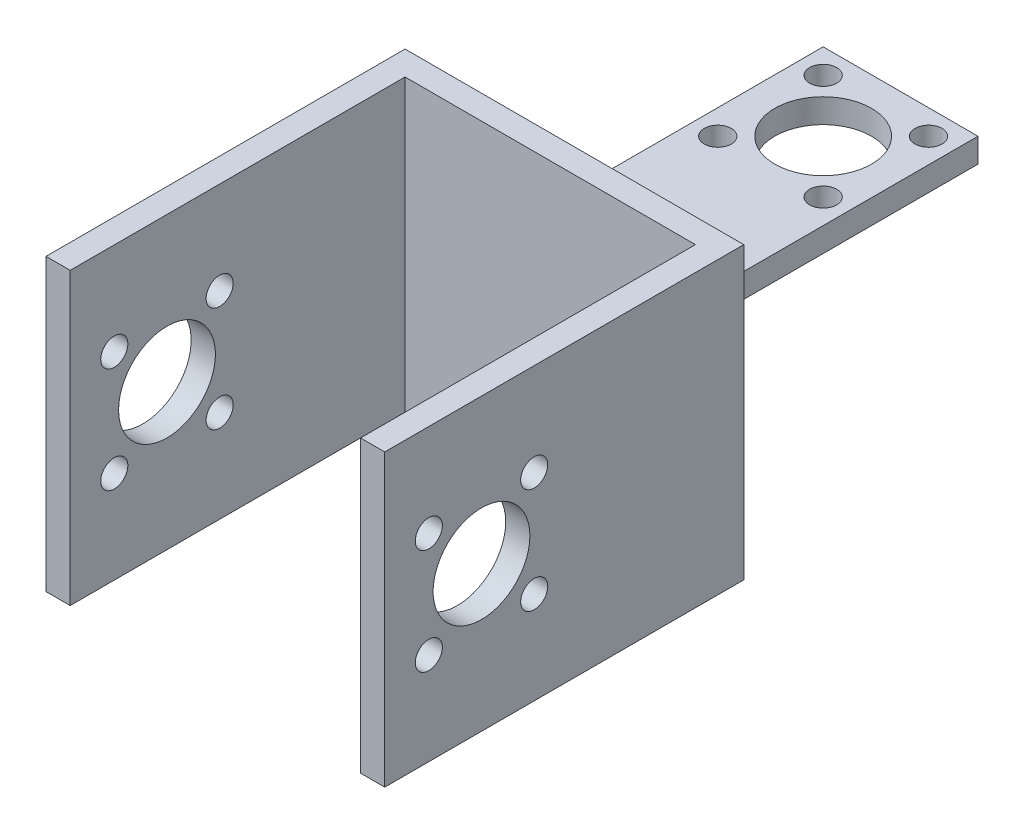
from build123d import *

# Parameters (mm, degrees)
BOSS_EXTRUDE1_DEPTH = 19.05
SKETCH3_W           = 20.32
SKETCH3_H           = 43.561
CUT_EXTRUDE1_DEPTH  = 19.05
SKETCH4_W           = 20.32
SKETCH4_H           = 43.561
CUT_EXTRUDE2_DEPTH  = 15.875
CUT_EXTRUDE3_REACH  = 100.572
SKETCH6_R           = 6.35
SKETCH6_R_2         = 1.778
CUT_EXTRUDE6_REACH  = 104.768
SKETCH9_R           = 6.35
SKETCH9_R_2         = 1.778
CUT_EXTRUDE7_REACH  = 104.768
SKETCH10_R          = 6.35
SKETCH10_R_2        = 1.778


with BuildPart() as part:
    # Sketch1 → Boss-Extrude1 (new, symmetric)
    with BuildSketch(Plane(origin=(0, 0, 0), x_dir=(1, 0, 0), z_dir=(0, 1, 0))):
        Polygon((0, 0), (-20.32, 0), (-20.32, -43.561), (-31.623, -43.561), (-31.623, -90.678), (-28.448, -90.678), (-28.448, -46.736), (9.652, -46.736), (9.652, -90.678), (12.827, -90.678), (12.827, -43.561), (0, -43.561), align=None)
    extrude(amount=BOSS_EXTRUDE1_DEPTH, both=True)

    # Sketch3 → Cut-Extrude1 (cut)
    with BuildSketch(Plane.XZ.offset(19.05)):
        with Locations((-10.16, 21.7805)):
            Rectangle(SKETCH3_W, SKETCH3_H)
    extrude(amount=-CUT_EXTRUDE1_DEPTH, mode=Mode.SUBTRACT)

    # Sketch4 → Cut-Extrude2 (cut)
    with BuildSketch(Plane(origin=(0, 19.05, 0), x_dir=(1, 0, 0), z_dir=(0, 1, 0))):
        with Locations((-10.16, -21.7805)):
            Rectangle(SKETCH4_W, SKETCH4_H)
    extrude(amount=-CUT_EXTRUDE2_DEPTH, mode=Mode.SUBTRACT)

    # Sketch6 → Cut-Extrude3 (cut, up to next)
    with BuildSketch(Plane(origin=(0, 3.175, 0), x_dir=(1, 0, 0), z_dir=(0, 1, 0)), mode=Mode.PRIVATE) as cut_extrude3_sk1:
        with Locations((-10.16, -10.16)):
            Circle(SKETCH6_R)
    cut_extrude3_tool1 = extrude(cut_extrude3_sk1.sketch, amount=-CUT_EXTRUDE3_REACH, mode=Mode.PRIVATE) & part.part
    # Sketch6 → Cut-Extrude3 (cut, up to next)
    with BuildSketch(Plane(origin=(0, 3.175, 0), x_dir=(1, 0, 0), z_dir=(0, 1, 0)), mode=Mode.PRIVATE) as cut_extrude3_sk2:
        with Locations((-17.074797213, -17.074797213)):
            Circle(SKETCH6_R_2)
    cut_extrude3_tool2 = extrude(cut_extrude3_sk2.sketch, amount=-CUT_EXTRUDE3_REACH, mode=Mode.PRIVATE) & part.part
    # Sketch6 → Cut-Extrude3 (cut, up to next)
    with BuildSketch(Plane(origin=(0, 3.175, 0), x_dir=(1, 0, 0), z_dir=(0, 1, 0)), mode=Mode.PRIVATE) as cut_extrude3_sk3:
        with Locations((-17.074797213, -3.245202787)):
            Circle(SKETCH6_R_2)
    cut_extrude3_tool3 = extrude(cut_extrude3_sk3.sketch, amount=-CUT_EXTRUDE3_REACH, mode=Mode.PRIVATE) & part.part
    # Sketch6 → Cut-Extrude3 (cut, up to next)
    with BuildSketch(Plane(origin=(0, 3.175, 0), x_dir=(1, 0, 0), z_dir=(0, 1, 0)), mode=Mode.PRIVATE) as cut_extrude3_sk4:
        with Locations((-3.245202787, -3.245202787)):
            Circle(SKETCH6_R_2)
    cut_extrude3_tool4 = extrude(cut_extrude3_sk4.sketch, amount=-CUT_EXTRUDE3_REACH, mode=Mode.PRIVATE) & part.part
    # Sketch6 → Cut-Extrude3 (cut, up to next)
    with BuildSketch(Plane(origin=(0, 3.175, 0), x_dir=(1, 0, 0), z_dir=(0, 1, 0)), mode=Mode.PRIVATE) as cut_extrude3_sk5:
        with Locations((-3.245202787, -17.074797213)):
            Circle(SKETCH6_R_2)
    cut_extrude3_tool5 = extrude(cut_extrude3_sk5.sketch, amount=-CUT_EXTRUDE3_REACH, mode=Mode.PRIVATE) & part.part
    add(cut_extrude3_tool1.solids().sort_by_distance((-10.16, 3.175, 10.16))[0], mode=Mode.SUBTRACT)
    add(cut_extrude3_tool2.solids().sort_by_distance((-17.074797, 3.175, 17.074797))[0], mode=Mode.SUBTRACT)
    add(cut_extrude3_tool3.solids().sort_by_distance((-17.074797, 3.175, 3.245203))[0], mode=Mode.SUBTRACT)
    add(cut_extrude3_tool4.solids().sort_by_distance((-3.245203, 3.175, 3.245203))[0], mode=Mode.SUBTRACT)
    add(cut_extrude3_tool5.solids().sort_by_distance((-3.245203, 3.175, 17.074797))[0], mode=Mode.SUBTRACT)

    # Sketch9 → Cut-Extrude6 (cut, up to next)
    with BuildSketch(Plane(origin=(12.827, 0, 0), x_dir=(0, 0, -1), z_dir=(1, 0, 0)), mode=Mode.PRIVATE) as cut_extrude6_sk1:
        with Locations((-77.978, 0)):
            Circle(SKETCH9_R)
    cut_extrude6_tool1 = extrude(cut_extrude6_sk1.sketch, amount=-CUT_EXTRUDE6_REACH, mode=Mode.PRIVATE) & part.part
    # Sketch9 → Cut-Extrude6 (cut, up to next)
    with BuildSketch(Plane(origin=(12.827, 0, 0), x_dir=(0, 0, -1), z_dir=(1, 0, 0)), mode=Mode.PRIVATE) as cut_extrude6_sk2:
        with Locations((-84.892797213, 6.914797213)):
            Circle(SKETCH9_R_2)
    cut_extrude6_tool2 = extrude(cut_extrude6_sk2.sketch, amount=-CUT_EXTRUDE6_REACH, mode=Mode.PRIVATE) & part.part
    # Sketch9 → Cut-Extrude6 (cut, up to next)
    with BuildSketch(Plane(origin=(12.827, 0, 0), x_dir=(0, 0, -1), z_dir=(1, 0, 0)), mode=Mode.PRIVATE) as cut_extrude6_sk3:
        with Locations((-71.063202787, 6.914797213)):
            Circle(SKETCH9_R_2)
    cut_extrude6_tool3 = extrude(cut_extrude6_sk3.sketch, amount=-CUT_EXTRUDE6_REACH, mode=Mode.PRIVATE) & part.part
    # Sketch9 → Cut-Extrude6 (cut, up to next)
    with BuildSketch(Plane(origin=(12.827, 0, 0), x_dir=(0, 0, -1), z_dir=(1, 0, 0)), mode=Mode.PRIVATE) as cut_extrude6_sk4:
        with Locations((-71.063202787, -6.914797213)):
            Circle(SKETCH9_R_2)
    cut_extrude6_tool4 = extrude(cut_extrude6_sk4.sketch, amount=-CUT_EXTRUDE6_REACH, mode=Mode.PRIVATE) & part.part
    # Sketch9 → Cut-Extrude6 (cut, up to next)
    with BuildSketch(Plane(origin=(12.827, 0, 0), x_dir=(0, 0, -1), z_dir=(1, 0, 0)), mode=Mode.PRIVATE) as cut_extrude6_sk5:
        with Locations((-84.892797213, -6.914797213)):
            Circle(SKETCH9_R_2)
    cut_extrude6_tool5 = extrude(cut_extrude6_sk5.sketch, amount=-CUT_EXTRUDE6_REACH, mode=Mode.PRIVATE) & part.part
    add(cut_extrude6_tool1.solids().sort_by_distance((12.827, 0, 77.978))[0], mode=Mode.SUBTRACT)
    add(cut_extrude6_tool2.solids().sort_by_distance((12.827, 6.914797, 84.892797))[0], mode=Mode.SUBTRACT)
    add(cut_extrude6_tool3.solids().sort_by_distance((12.827, 6.914797, 71.063203))[0], mode=Mode.SUBTRACT)
    add(cut_extrude6_tool4.solids().sort_by_distance((12.827, -6.914797, 71.063203))[0], mode=Mode.SUBTRACT)
    add(cut_extrude6_tool5.solids().sort_by_distance((12.827, -6.914797, 84.892797))[0], mode=Mode.SUBTRACT)

    # Sketch10 → Cut-Extrude7 (cut, up to next)
    with BuildSketch(Plane.ZY.offset(31.623), mode=Mode.PRIVATE) as cut_extrude7_sk1:
        with Locations((77.978, 0)):
            Circle(SKETCH10_R)
    cut_extrude7_tool1 = extrude(cut_extrude7_sk1.sketch, amount=-CUT_EXTRUDE7_REACH, mode=Mode.PRIVATE) & part.part
    # Sketch10 → Cut-Extrude7 (cut, up to next)
    with BuildSketch(Plane.ZY.offset(31.623), mode=Mode.PRIVATE) as cut_extrude7_sk2:
        with Locations((71.063202787, 6.914797213)):
            Circle(SKETCH10_R_2)
    cut_extrude7_tool2 = extrude(cut_extrude7_sk2.sketch, amount=-CUT_EXTRUDE7_REACH, mode=Mode.PRIVATE) & part.part
    # Sketch10 → Cut-Extrude7 (cut, up to next)
    with BuildSketch(Plane.ZY.offset(31.623), mode=Mode.PRIVATE) as cut_extrude7_sk3:
        with Locations((84.892797213, 6.914797213)):
            Circle(SKETCH10_R_2)
    cut_extrude7_tool3 = extrude(cut_extrude7_sk3.sketch, amount=-CUT_EXTRUDE7_REACH, mode=Mode.PRIVATE) & part.part
    # Sketch10 → Cut-Extrude7 (cut, up to next)
    with BuildSketch(Plane.ZY.offset(31.623), mode=Mode.PRIVATE) as cut_extrude7_sk4:
        with Locations((84.892797213, -6.914797213)):
            Circle(SKETCH10_R_2)
    cut_extrude7_tool4 = extrude(cut_extrude7_sk4.sketch, amount=-CUT_EXTRUDE7_REACH, mode=Mode.PRIVATE) & part.part
    # Sketch10 → Cut-Extrude7 (cut, up to next)
    with BuildSketch(Plane.ZY.offset(31.623), mode=Mode.PRIVATE) as cut_extrude7_sk5:
        with Locations((71.063202787, -6.914797213)):
            Circle(SKETCH10_R_2)
    cut_extrude7_tool5 = extrude(cut_extrude7_sk5.sketch, amount=-CUT_EXTRUDE7_REACH, mode=Mode.PRIVATE) & part.part
    add(cut_extrude7_tool1.solids().sort_by_distance((-31.623, 0, 77.978))[0], mode=Mode.SUBTRACT)
    add(cut_extrude7_tool2.solids().sort_by_distance((-31.623, 6.914797, 71.063203))[0], mode=Mode.SUBTRACT)
    add(cut_extrude7_tool3.solids().sort_by_distance((-31.623, 6.914797, 84.892797))[0], mode=Mode.SUBTRACT)
    add(cut_extrude7_tool4.solids().sort_by_distance((-31.623, -6.914797, 84.892797))[0], mode=Mode.SUBTRACT)
    add(cut_extrude7_tool5.solids().sort_by_distance((-31.623, -6.914797, 71.063203))[0], mode=Mode.SUBTRACT)


solid = part.part
